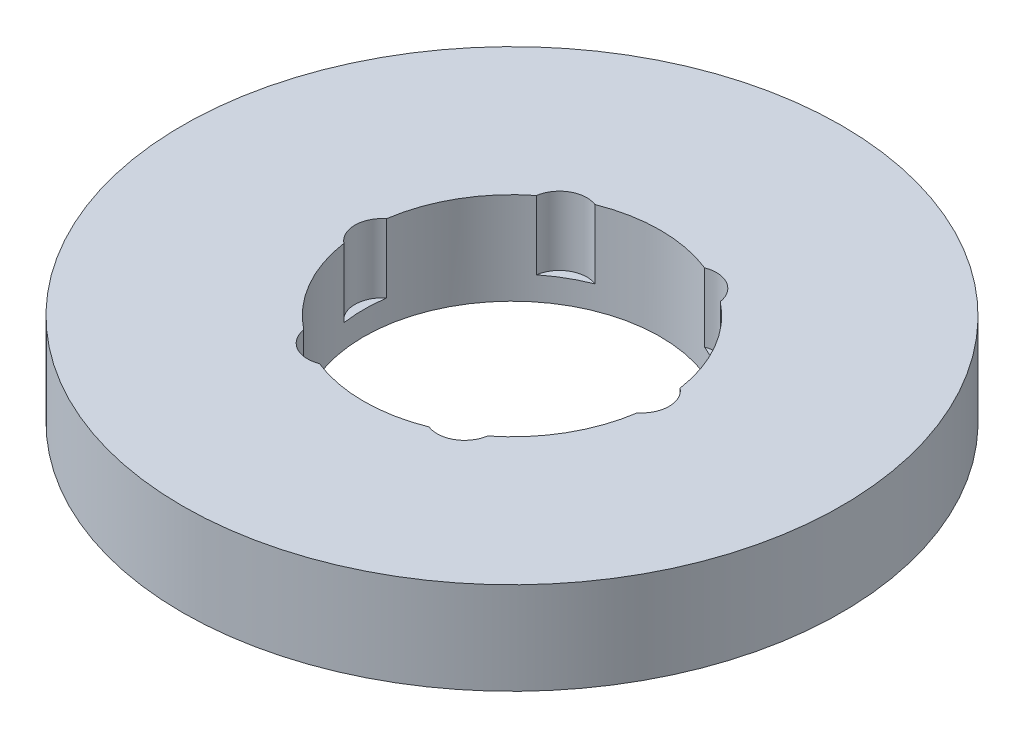
from build123d import *

# Parameters (mm, degrees)
SKETCH1_R           = 100
BOSS_EXTRUDE1_DEPTH = 28
SKETCH2_R           = 45
CUT_EXTRUDE1_DEPTH  = 145.166570328
SKETCH3_R           = 8.310454224
CUT_EXTRUDE2_DEPTH  = 20.850165171
CIRPATTERN1_COUNT   = 6


with BuildPart() as part:
    # Sketch1 → Boss-Extrude1 (new body)
    with BuildSketch(Plane(origin=(0, 0, 0), x_dir=(1, 0, 0), z_dir=(0, 1, 0))):
        Circle(SKETCH1_R)
    extrude(amount=BOSS_EXTRUDE1_DEPTH)

    # Sketch2 → Cut-Extrude1 (cut, through all)
    with BuildSketch(Plane(origin=(0, 0, 0), x_dir=(1, 0, 0), z_dir=(0, 1, 0))):
        Circle(SKETCH2_R)
    extrude(amount=CUT_EXTRUDE1_DEPTH, mode=Mode.SUBTRACT)

    # Sketch3 → Cut-Extrude2 (cut)
    with BuildSketch(Plane(origin=(0, 28, 0), x_dir=(1, 0, 0), z_dir=(0, 1, 0))):
        with Locations((-39.341250026, 0)):
            Circle(SKETCH3_R)
    cut_extrude2 = extrude(amount=-CUT_EXTRUDE2_DEPTH, mode=Mode.SUBTRACT)

    # CirPattern1: Cut-Extrude2 ×6 about axis
    cirpattern1_axis = Axis((0, 0, 0), (0, 1, 0))
    for i in range(1, CIRPATTERN1_COUNT):
        add(cut_extrude2.rotate(cirpattern1_axis, i * 360 / CIRPATTERN1_COUNT), mode=Mode.SUBTRACT)


solid = part.part
